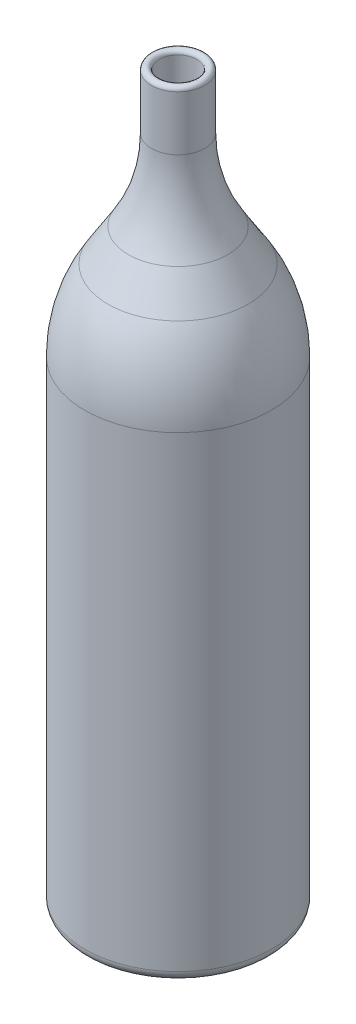
from build123d import *

# Parameters (mm, degrees)
SHELL1_T  = -3
FILLET1_R = 1.5


with BuildPart() as part:
    # Sketch2 → Revolve1 (revolve)
    with BuildSketch(Plane.XY, mode=Mode.PRIVATE) as revolve1_sk:
        with BuildLine():
            Line((0, 274), (-10, 274))
            Line((-10, 274), (-10, 252))
            ThreePointArc((-10, 252), (-12.208083332, 236.288670718), (-18.661258519, 221.794601939))
            Line((-18.661258519, 221.794601939), (-26.338741481, 209.508060859))
            ThreePointArc((-26.338741481, 209.508060859), (-32.791916668, 195.013992079), (-35, 179.302662797))
            Line((-35, 179.302662797), (-35, 4))
            ThreePointArc((-35, 4), (-33.828427125, 1.171572875), (-31, 0))
            Line((-31, 0), (-29, 0))
            ThreePointArc((-29, 0), (-25.705033601, 0.424500152), (-22.625253932, 1.670277472))
            Line((-22.625253932, 1.670277472), (-4.658468281, 11.779412617))
            ThreePointArc((-4.658468281, 11.779412617), (-2.40786006, 12.689788351), (0, 13))
            Line((0, 13), (0, 274))
        make_face()
    revolve(revolve1_sk.sketch.rotate(Axis((0, 0, 0), (0, 1, 0)), 270), axis=Axis((0, 0, 0), (0, 1, 0)))

    # Shell1
    shell1_openings = [part.faces().sort_by_distance(p)[0] for p in [
        (0, 274, 0),
    ]]
    offset(amount=SHELL1_T, openings=shell1_openings, kind=Kind.INTERSECTION)

    # Fillet1
    fillet1_edges = [part.edges().sort_by_distance(p)[0] for p in [
        (0, 274, 7),
        (0, 274, 10),
    ]]
    fillet(fillet1_edges, radius=FILLET1_R - 0.0001)  # a hair under: the kernel refuses the full size


solid = part.part
